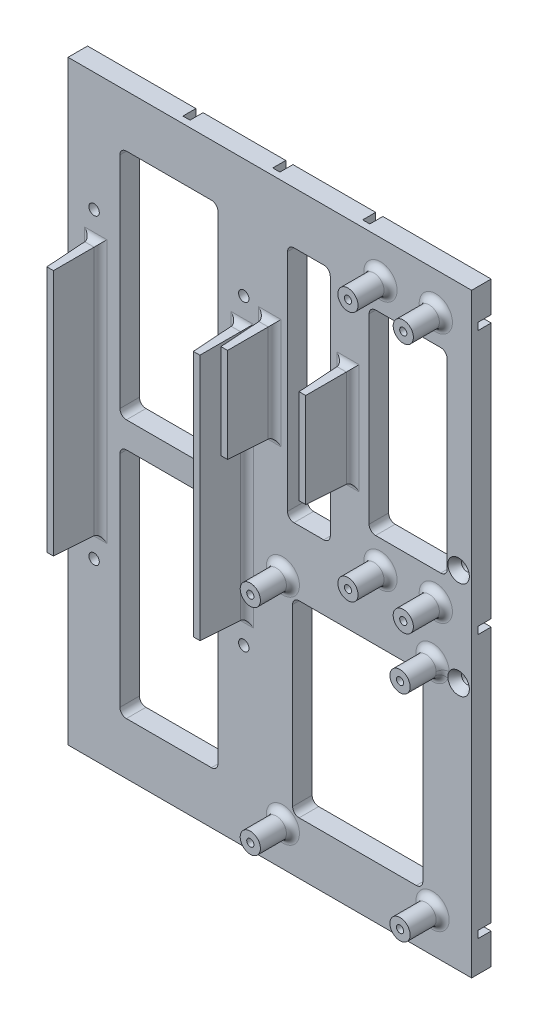
from build123d import *

# Parameters (mm, degrees)
SKETCH1_W                     = 183
SKETCH1_H                     = 124
SKETCH1_R                     = 1.6
BOSS_EXTRUDE1_DEPTH           = 6
EXTRUDE_THIN1_START           = 6
SKETCH1_4_W                   = 76.95341554
SKETCH1_4_H                   = 3
EXTRUDE_THIN1_DEPTH           = 14
EXTRUDE_THIN1_DRAFT           = 2
SKETCH1_4_W_2                 = 30
EXTRUDE_THIN1_PROFILE_2_DEPTH = 14
EXTRUDE_THIN1_PROFILE_2_DRAFT = 2
EXTRUDE_THIN2_START           = 6
SKETCH1_5_W                   = 76.95341554
SKETCH1_5_H                   = 3
EXTRUDE_THIN2_DEPTH           = 14
EXTRUDE_THIN2_DRAFT           = 2
SKETCH1_5_W_2                 = 30
EXTRUDE_THIN2_PROFILE_2_DEPTH = 14
EXTRUDE_THIN2_PROFILE_2_DRAFT = 2
EXTRUDE_THIN3_START           = 6
SKETCH1_6_R                   = 3.1
SKETCH1_6_R_2                 = 1.1
EXTRUDE_THIN3_DEPTH           = 10
SKETCH2_W                     = 2.2
SKETCH2_H                     = 4
CUT_EXTRUDE2_DEPTH            = 198.668915108
SKETCH3_W                     = 2.2
SKETCH3_H                     = 4
CUT_EXTRUDE3_DEPTH            = 197.410284863
CUT_EXTRUDE4_REACH            = 199.669
SKETCH4_W                     = 2.2
SKETCH4_H                     = 4
CHAMFER1_SIZE                 = 1.7
CHAMFER1_SIZE_2               = 2.5
FILLET1_R                     = 2
CUT_EXTRUDE5_DEPTH            = 168.871975037


with BuildPart() as part:
    # Sketch1 → Boss-Extrude1 (new body)
    with BuildSketch(Plane(origin=(0, 0, 0), x_dir=(0, 1, 0), z_dir=(0, 0, 1))):
        with Locations((59.5, -10)):
            Rectangle(SKETCH1_W, SKETCH1_H)
        with Locations(Location((44.5, -68, 0), (0, 0, 270))):
            Circle(SKETCH1_R, mode=Mode.SUBTRACT)
        with Locations(Location((74.5, -68, 0), (0, 0, 270))):
            Circle(SKETCH1_R, mode=Mode.SUBTRACT)
        with Locations(Location((21.52329223, -2, 0), (0, 0, 270))):
            Circle(SKETCH1_R, mode=Mode.SUBTRACT)
        with Locations(Location((21.52329223, 44, 0), (0, 0, 270))):
            Circle(SKETCH1_R, mode=Mode.SUBTRACT)
        with Locations(Location((44.5, 48, 0), (0, 0, 270))):
            Circle(SKETCH1_R, mode=Mode.SUBTRACT)
        with Locations(Location((74.5, 48, 0), (0, 0, 270))):
            Circle(SKETCH1_R, mode=Mode.SUBTRACT)
        with Locations(Location((114.47670777, -2, 0), (0, 0, 270))):
            Circle(SKETCH1_R, mode=Mode.SUBTRACT)
        with Locations(Location((114.47670777, 44, 0), (0, 0, 270))):
            Circle(SKETCH1_R, mode=Mode.SUBTRACT)
    extrude(amount=BOSS_EXTRUDE1_DEPTH)


with BuildPart() as extrude_thin1_tool:
    # Sketch1<4> → Extrude-Thin1 (with draft: the straight prism first)
    with BuildSketch(Plane(origin=(0, 0, 0), x_dir=(0, 1, 0), z_dir=(0, 0, 1)).offset(EXTRUDE_THIN1_START)):
        with Locations((68, 43.5)):
            Rectangle(SKETCH1_4_W, SKETCH1_4_H)
    extrude(amount=EXTRUDE_THIN1_DEPTH)
    # Extrude-Thin1: the draft: its side faces are tilted about the plane it starts from
    extrude_thin1_sides = [extrude_thin1_tool.faces().sort_by_distance(p)[0] for p in [
        (-42, 68, 13),
        (-43.5, 106.47670777, 13),
        (-45, 68, 13),
        (-43.5, 29.52329223, 13),
    ]]
    draft(extrude_thin1_sides, Plane(origin=(0, 0, 0), x_dir=(0, 1, 0), z_dir=(0, 0, 1)).offset(EXTRUDE_THIN1_START), EXTRUDE_THIN1_DRAFT)


with BuildPart() as part_1:
    add(part.part)

    # Extrude-Thin1: add extrude_thin1_tool
    add(extrude_thin1_tool.part)


with BuildPart() as extrude_thin1_profile_2_tool:
    # Sketch1<4> → Extrude-Thin1 profile 2 (with draft: the straight prism first)
    with BuildSketch(Plane(origin=(0, 0, 0), x_dir=(0, 1, 0), z_dir=(0, 0, 1)).offset(EXTRUDE_THIN1_START)):
        with Locations((97, -10)):
            Rectangle(SKETCH1_4_W_2, SKETCH1_4_H)
    extrude(amount=EXTRUDE_THIN1_PROFILE_2_DEPTH)
    # Extrude-Thin1 profile 2: the draft: its side faces are tilted about the plane it starts from
    extrude_thin1_profile_2_sides = [extrude_thin1_profile_2_tool.faces().sort_by_distance(p)[0] for p in [
        (11.5, 97, 13),
        (10, 112, 13),
        (8.5, 97, 13),
        (10, 82, 13),
    ]]
    draft(extrude_thin1_profile_2_sides, Plane(origin=(0, 0, 0), x_dir=(0, 1, 0), z_dir=(0, 0, 1)).offset(EXTRUDE_THIN1_START), EXTRUDE_THIN1_PROFILE_2_DRAFT)


with BuildPart() as part_2:
    add(part_1.part)

    # Extrude-Thin1 profile 2: add extrude_thin1_profile_2_tool
    add(extrude_thin1_profile_2_tool.part)


with BuildPart() as extrude_thin2_tool:
    # Sketch1<5> → Extrude-Thin2 (with draft: the straight prism first)
    with BuildSketch(Plane(origin=(0, 0, 0), x_dir=(0, 1, 0), z_dir=(0, 0, 1)).offset(EXTRUDE_THIN2_START)):
        with Locations((68, -1.5)):
            Rectangle(SKETCH1_5_W, SKETCH1_5_H)
    extrude(amount=EXTRUDE_THIN2_DEPTH)
    # Extrude-Thin2: the draft: its side faces are tilted about the plane it starts from
    extrude_thin2_sides = [extrude_thin2_tool.faces().sort_by_distance(p)[0] for p in [
        (1.5, 29.52329223, 13),
        (3, 68, 13),
        (1.5, 106.47670777, 13),
        (0, 68, 13),
    ]]
    draft(extrude_thin2_sides, Plane(origin=(0, 0, 0), x_dir=(0, 1, 0), z_dir=(0, 0, 1)).offset(EXTRUDE_THIN2_START), EXTRUDE_THIN2_DRAFT)


with BuildPart() as part_3:
    add(part_2.part)

    # Extrude-Thin2: add extrude_thin2_tool
    add(extrude_thin2_tool.part)


with BuildPart() as extrude_thin2_profile_2_tool:
    # Sketch1<5> → Extrude-Thin2 profile 2 (with draft: the straight prism first)
    with BuildSketch(Plane(origin=(0, 0, 0), x_dir=(0, 1, 0), z_dir=(0, 0, 1)).offset(EXTRUDE_THIN2_START)):
        with Locations((97, -34)):
            Rectangle(SKETCH1_5_W_2, SKETCH1_5_H)
    extrude(amount=EXTRUDE_THIN2_PROFILE_2_DEPTH)
    # Extrude-Thin2 profile 2: the draft: its side faces are tilted about the plane it starts from
    extrude_thin2_profile_2_sides = [extrude_thin2_profile_2_tool.faces().sort_by_distance(p)[0] for p in [
        (34, 82, 13),
        (35.5, 97, 13),
        (34, 112, 13),
        (32.5, 97, 13),
    ]]
    draft(extrude_thin2_profile_2_sides, Plane(origin=(0, 0, 0), x_dir=(0, 1, 0), z_dir=(0, 0, 1)).offset(EXTRUDE_THIN2_START), EXTRUDE_THIN2_PROFILE_2_DRAFT)


with BuildPart() as part_4:
    add(part_3.part)

    # Extrude-Thin2 profile 2: add extrude_thin2_profile_2_tool
    add(extrude_thin2_profile_2_tool.part)

    # Sketch1<6> → Extrude-Thin3 (add)
    # profile 1 of 8: a face of its own
    with BuildSketch(Plane(origin=(0, 0, 0), x_dir=(0, 1, 0), z_dir=(0, 0, 1)).offset(EXTRUDE_THIN3_START)):
        with Locations((-20, -14)):
            Circle(SKETCH1_6_R)
        with Locations((-20, -14)):
            Circle(SKETCH1_6_R_2, mode=Mode.SUBTRACT)
    # profile 2 of 8: a face of its own
    with BuildSketch(Plane(origin=(0, 0, 0), x_dir=(0, 1, 0), z_dir=(0, 0, 1)).offset(EXTRUDE_THIN3_START)):
        with Locations((46, -14)):
            Circle(SKETCH1_6_R)
        with Locations((46, -14)):
            Circle(SKETCH1_6_R_2, mode=Mode.SUBTRACT)
    # profile 3 of 8: a face of its own
    with BuildSketch(Plane(origin=(0, 0, 0), x_dir=(0, 1, 0), z_dir=(0, 0, 1)).offset(EXTRUDE_THIN3_START)):
        with Locations((-20, -60)):
            Circle(SKETCH1_6_R)
        with Locations((-20, -60)):
            Circle(SKETCH1_6_R_2, mode=Mode.SUBTRACT)
    # profile 4 of 8: a face of its own
    with BuildSketch(Plane(origin=(0, 0, 0), x_dir=(0, 1, 0), z_dir=(0, 0, 1)).offset(EXTRUDE_THIN3_START)):
        with Locations((46, -60)):
            Circle(SKETCH1_6_R)
        with Locations((46, -60)):
            Circle(SKETCH1_6_R_2, mode=Mode.SUBTRACT)
    # profile 5 of 8: a face of its own
    with BuildSketch(Plane(origin=(0, 0, 0), x_dir=(0, 1, 0), z_dir=(0, 0, 1)).offset(EXTRUDE_THIN3_START)):
        with Locations((62.5, -44)):
            Circle(SKETCH1_6_R)
        with Locations((62.5, -44)):
            Circle(SKETCH1_6_R_2, mode=Mode.SUBTRACT)
    # profile 6 of 8: a face of its own
    with BuildSketch(Plane(origin=(0, 0, 0), x_dir=(0, 1, 0), z_dir=(0, 0, 1)).offset(EXTRUDE_THIN3_START)):
        with Locations((139.5, -44)):
            Circle(SKETCH1_6_R)
        with Locations((139.5, -44)):
            Circle(SKETCH1_6_R_2, mode=Mode.SUBTRACT)
    # profile 7 of 8: a face of its own
    with BuildSketch(Plane(origin=(0, 0, 0), x_dir=(0, 1, 0), z_dir=(0, 0, 1)).offset(EXTRUDE_THIN3_START)):
        with Locations((62.5, -61)):
            Circle(SKETCH1_6_R)
        with Locations((62.5, -61)):
            Circle(SKETCH1_6_R_2, mode=Mode.SUBTRACT)
    # profile 8 of 8: a face of its own
    with BuildSketch(Plane(origin=(0, 0, 0), x_dir=(0, 1, 0), z_dir=(0, 0, 1)).offset(EXTRUDE_THIN3_START)):
        with Locations((139.5, -61)):
            Circle(SKETCH1_6_R)
        with Locations((139.5, -61)):
            Circle(SKETCH1_6_R_2, mode=Mode.SUBTRACT)
    extrude(amount=EXTRUDE_THIN3_DEPTH)

    # Sketch2 → Cut-Extrude2 (cut, through all)
    with BuildSketch(Plane.XZ.offset(32)):
        with Locations((10, 2)):
            Rectangle(SKETCH2_W, SKETCH2_H)
    extrude(amount=-CUT_EXTRUDE2_DEPTH, mode=Mode.SUBTRACT)

    # Sketch3 → Cut-Extrude3 (cut, through all)
    with BuildSketch(Plane.YZ.offset(72)):
        with Locations((59.5, 2)):
            Rectangle(SKETCH3_W, SKETCH3_H)
        with Locations((-21.4, 2)):
            Rectangle(SKETCH3_W, SKETCH3_H)
        with Locations((140.4, 2)):
            Rectangle(SKETCH3_W, SKETCH3_H)
    extrude(amount=-CUT_EXTRUDE3_DEPTH, mode=Mode.SUBTRACT)

    # Sketch4 → Cut-Extrude4 (cut, up to next)
    with BuildSketch(Plane.XZ.offset(32), mode=Mode.PRIVATE) as cut_extrude4_sk1:
        with Locations((37.62, 2)):
            Rectangle(SKETCH4_W, SKETCH4_H)
    cut_extrude4_tool1 = extrude(cut_extrude4_sk1.sketch, amount=-CUT_EXTRUDE4_REACH, mode=Mode.PRIVATE) & part_4.part
    # Sketch4 → Cut-Extrude4 (cut, up to next)
    with BuildSketch(Plane.XZ.offset(32), mode=Mode.PRIVATE) as cut_extrude4_sk2:
        with Locations((-17.62, 2)):
            Rectangle(SKETCH4_W, SKETCH4_H)
    cut_extrude4_tool2 = extrude(cut_extrude4_sk2.sketch, amount=-CUT_EXTRUDE4_REACH, mode=Mode.PRIVATE) & part_4.part
    cut_extrude4_1 = cut_extrude4_tool1.solids().sort_by_distance((37.62, -32, 2))[0]
    add(cut_extrude4_1, mode=Mode.SUBTRACT)
    cut_extrude4_2 = cut_extrude4_tool2.solids().sort_by_distance((-17.62, -32, 2))[0]
    add(cut_extrude4_2, mode=Mode.SUBTRACT)
    cut_extrude4 = cut_extrude4_1 + cut_extrude4_2  # Cut-Extrude4 as one shape, for the pattern or mirror that repeats it

    # Mirror1: Cut-Extrude4 across plane
    add(cut_extrude4.mirror(Plane(origin=(0, 59.5, 0), x_dir=(0, 0, 1), z_dir=(0, -1, 0))), mode=Mode.SUBTRACT)

    # Chamfer1
    # the kernel refuses this chamfer: 2.5, 1.7 mm, written as the material it takes off along each edge
    with BuildSketch(Plane(origin=(68, 74.5, 6), x_dir=(1, 0, 0), z_dir=(0, -1, 0))) as chamfer1_piece_1:
        Polygon((1.6 + CHAMFER1_SIZE, 0), (1.6, -CHAMFER1_SIZE_2), (1.6, 0), align=None)
    revolve(axis=Axis((68, 74.5, 6), (0, 0, 1)), mode=Mode.SUBTRACT)
    with BuildSketch(Plane(origin=(68, 44.5, 6), x_dir=(1, 0, 0), z_dir=(0, -1, 0))) as chamfer1_piece_2:
        Polygon((1.6 + CHAMFER1_SIZE, 0), (1.6, -CHAMFER1_SIZE_2), (1.6, 0), align=None)
    revolve(axis=Axis((68, 44.5, 6), (0, 0, 1)), mode=Mode.SUBTRACT)
    with BuildSketch(Plane(origin=(-48, 74.5, 6), x_dir=(1, 0, 0), z_dir=(0, -1, 0))) as chamfer1_piece_3_section:
        Polygon((1.6 + CHAMFER1_SIZE, 0), (1.6, -CHAMFER1_SIZE_2), (1.6, 0), align=None)
    chamfer1_piece_3 = revolve(axis=Axis((-48, 74.5, 6), (0, 0, 1)), mode=Mode.PRIVATE)
    chamfer1_piece_3 = split(chamfer1_piece_3, bisect_by=Plane(origin=(-45.049580587, 74.5, 4.58019775), z_dir=(-0.9993908270190958, 0, 0.03489949670250102)), keep=Keep.TOP, mode=Mode.PRIVATE)
    add(chamfer1_piece_3, mode=Mode.SUBTRACT)
    with BuildSketch(Plane(origin=(-48, 44.5, 6), x_dir=(1, 0, 0), z_dir=(0, -1, 0))) as chamfer1_piece_4_section:
        Polygon((1.6 + CHAMFER1_SIZE, 0), (1.6, -CHAMFER1_SIZE_2), (1.6, 0), align=None)
    chamfer1_piece_4 = revolve(axis=Axis((-48, 44.5, 6), (0, 0, 1)), mode=Mode.PRIVATE)
    chamfer1_piece_4 = split(chamfer1_piece_4, bisect_by=Plane(origin=(-45.049580587, 44.5, 4.58019775), z_dir=(-0.9993908270190958, 0, 0.03489949670250102)), keep=Keep.TOP, mode=Mode.PRIVATE)
    add(chamfer1_piece_4, mode=Mode.SUBTRACT)

    # Fillet1
    fillet1_edges = [part_4.edges().sort_by_distance(p)[0] for p in [
        (61, 136.4, 6),
        (60, -23.1, 6),
        (60, 42.9, 6),
        (14, -23.1, 6),
        (44, 136.4, 6),
        (44, 59.4, 6),
        (61, 59.4, 6),
        (14, 42.9, 6),
        (-45, 59.5, 6),
        (-45, 36.324259761, 6),
        (-43.5, 29.52329223, 6),
        (-43.5, 106.47670777, 6),
        (-45, 91.175740239, 6),
        (-42, 68, 6),
        (10, 82, 6),
        (10, 112, 6),
        (8.5, 97, 6),
        (11.5, 97, 6),
        (34, 82, 6),
        (34, 112, 6),
        (32.5, 97, 6),
        (35.5, 97, 6),
        (1.5, 29.52329223, 6),
        (1.5, 106.47670777, 6),
        (0, 68, 6),
        (3, 68, 6),
    ]]
    fillet(fillet1_edges, radius=FILLET1_R)

    # Sketch5 → Cut-Extrude5 (cut, through all)
    with BuildSketch(Plane.XY.offset(6)):
        with BuildLine():
            Line((-34.06862245, 135), (-7.93137755, 135))
            ThreePointArc((-7.93137755, 135), (-6.517163987, 134.414213562), (-5.93137755, 133))
            Line((-5.93137755, 133), (-5.93137755, 65.5))
            ThreePointArc((-5.93137755, 65.5), (-6.517163987, 64.085786438), (-7.93137755, 63.5))
            Line((-7.93137755, 63.5), (-34.06862245, 63.5))
            ThreePointArc((-34.06862245, 63.5), (-35.482836013, 64.085786438), (-36.06862245, 65.5))
            Line((-36.06862245, 65.5), (-36.06862245, 133))
            ThreePointArc((-36.06862245, 133), (-35.482836013, 134.414213562), (-34.06862245, 135))
        make_face()
        with BuildLine():
            Line((19, 41.875681875), (55, 41.875681875))
            ThreePointArc((55, 41.875681875), (56.414213562, 41.289895437), (57, 39.875681875))
            Line((57, 39.875681875), (57, -13.875681875))
            ThreePointArc((57, -13.875681875), (56.414213562, -15.289895437), (55, -15.875681875))
            Line((55, -15.875681875), (19, -15.875681875))
            ThreePointArc((19, -15.875681875), (17.585786438, -15.289895437), (17, -13.875681875))
            Line((17, -13.875681875), (17, 39.875681875))
            ThreePointArc((17, 39.875681875), (17.585786438, 41.289895437), (19, 41.875681875))
        make_face()
        with BuildLine():
            Line((42.5, 131), (62.5, 131))
            ThreePointArc((62.5, 131), (63.914213562, 130.414213562), (64.5, 129))
            Line((64.5, 129), (64.5, 73))
            ThreePointArc((64.5, 73), (63.914213562, 71.585786438), (62.5, 71))
            Line((62.5, 71), (42.5, 71))
            ThreePointArc((42.5, 71), (41.085786438, 71.585786438), (40.5, 73))
            Line((40.5, 73), (40.5, 129))
            ThreePointArc((40.5, 129), (41.085786438, 130.414213562), (42.5, 131))
        make_face()
        with BuildLine():
            Line((-34.06862245, 55.5), (-7.93137755, 55.5))
            ThreePointArc((-7.93137755, 55.5), (-6.517163987, 54.914213562), (-5.93137755, 53.5))
            Line((-5.93137755, 53.5), (-5.93137755, -14))
            ThreePointArc((-5.93137755, -14), (-6.517163987, -15.414213562), (-7.93137755, -16))
            Line((-7.93137755, -16), (-34.06862245, -16))
            ThreePointArc((-34.06862245, -16), (-35.482836013, -15.414213562), (-36.06862245, -14))
            Line((-36.06862245, -14), (-36.06862245, 53.5))
            ThreePointArc((-36.06862245, 53.5), (-35.482836013, 54.914213562), (-34.06862245, 55.5))
        make_face()
        with BuildLine():
            Line((17.43137755, 135), (26.56862245, 135))
            ThreePointArc((26.56862245, 135), (27.982836013, 134.414213562), (28.56862245, 133))
            Line((28.56862245, 133), (28.56862245, 63.875681875))
            ThreePointArc((28.56862245, 63.875681875), (27.982836013, 62.461468312), (26.56862245, 61.875681875))
            Line((26.56862245, 61.875681875), (17.43137755, 61.875681875))
            ThreePointArc((17.43137755, 61.875681875), (16.017163987, 62.461468312), (15.43137755, 63.875681875))
            Line((15.43137755, 63.875681875), (15.43137755, 133))
            ThreePointArc((15.43137755, 133), (16.017163987, 134.414213562), (17.43137755, 135))
        make_face()
    extrude(amount=-CUT_EXTRUDE5_DEPTH, mode=Mode.SUBTRACT)


solid = part_4.part
